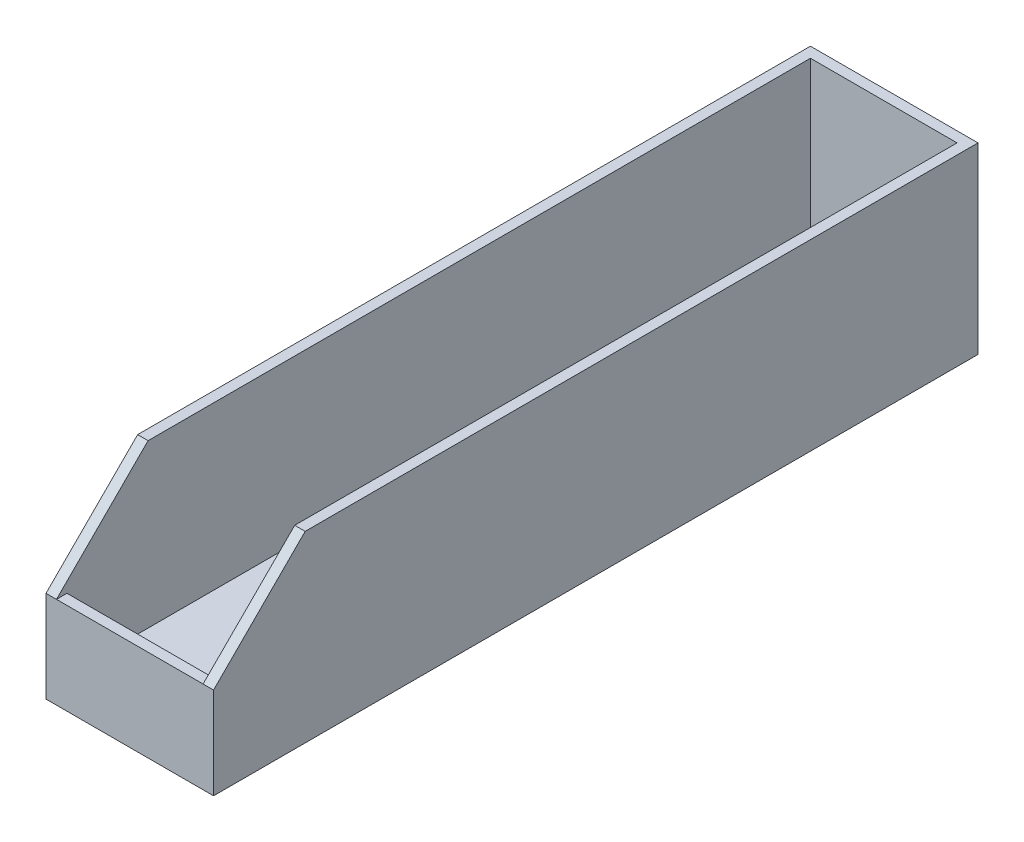
from build123d import *

# Parameters (mm, degrees)
SKETCH1_W           = 28
SKETCH1_H           = 142
BOSS_EXTRUDE1_DEPTH = 4
BOSS_EXTRUDE2_DEPTH = 35
SKETCH1_5_W         = 28
SKETCH1_5_H         = 2
BOSS_EXTRUDE3_DEPTH = 17.5
CUT_EXTRUDE1_REACH  = 82.907
SKETCH2_R           = 1.75
SKETCH2_3_R         = 3.15
SKETCH2_3_R_2       = 1.75
CUT_EXTRUDE2_DEPTH  = 2
CUT_EXTRUDE3_DEPTH  = 88.051708771


with BuildPart() as part:
    # Sketch1 → Boss-Extrude1 (new body)
    with BuildSketch(Plane(origin=(0, 0, 0), x_dir=(1, 0, 0), z_dir=(0, 1, 0))):
        Rectangle(SKETCH1_W, SKETCH1_H)
    extrude(amount=BOSS_EXTRUDE1_DEPTH)

    # Sketch1<4> → Boss-Extrude2 (add)
    with BuildSketch(Plane(origin=(0, 0, 0), x_dir=(1, 0, 0), z_dir=(0, 1, 0))):
        Polygon((-14, -73), (-14, -71), (-14, 71), (14, 71), (14, -71), (14, -73), (16, -73), (16, 73), (-16, 73), (-16, -73), align=None)
    extrude(amount=BOSS_EXTRUDE2_DEPTH)

    # Sketch1<5> → Boss-Extrude3 (add)
    with BuildSketch(Plane(origin=(0, 0, 0), x_dir=(1, 0, 0), z_dir=(0, 1, 0))):
        with Locations((0, -72)):
            Rectangle(SKETCH1_5_W, SKETCH1_5_H)
    extrude(amount=BOSS_EXTRUDE3_DEPTH)

    # Sketch2 → Cut-Extrude1 (cut, up to next)
    with BuildSketch(Plane(origin=(0, 4, 0), x_dir=(1, 0, 0), z_dir=(0, 1, 0)), mode=Mode.PRIVATE) as cut_extrude1_sk1:
        with Locations((0, 30)):
            Circle(SKETCH2_R)
    cut_extrude1_tool1 = extrude(cut_extrude1_sk1.sketch, amount=-CUT_EXTRUDE1_REACH, mode=Mode.PRIVATE) & part.part
    # Sketch2 → Cut-Extrude1 (cut, up to next)
    with BuildSketch(Plane(origin=(0, 4, 0), x_dir=(1, 0, 0), z_dir=(0, 1, 0)), mode=Mode.PRIVATE) as cut_extrude1_sk2:
        with Locations((0, -30)):
            Circle(SKETCH2_R)
    cut_extrude1_tool2 = extrude(cut_extrude1_sk2.sketch, amount=-CUT_EXTRUDE1_REACH, mode=Mode.PRIVATE) & part.part
    add(cut_extrude1_tool1.solids().sort_by_distance((0, 4, -30))[0], mode=Mode.SUBTRACT)
    add(cut_extrude1_tool2.solids().sort_by_distance((0, 4, 30))[0], mode=Mode.SUBTRACT)

    # Sketch2<3> → Cut-Extrude2 (cut)
    # profile 1 of 2: a face of its own
    with BuildSketch(Plane(origin=(0, 4, 0), x_dir=(1, 0, 0), z_dir=(0, 1, 0))):
        with Locations((0, 30)):
            Circle(SKETCH2_3_R)
        with Locations((0, 30)):
            Circle(SKETCH2_3_R_2, mode=Mode.SUBTRACT)
    # profile 2 of 2: a face of its own
    with BuildSketch(Plane(origin=(0, 4, 0), x_dir=(1, 0, 0), z_dir=(0, 1, 0))):
        with Locations((0, -30)):
            Circle(SKETCH2_3_R)
        with Locations((0, -30)):
            Circle(SKETCH2_3_R_2, mode=Mode.SUBTRACT)
    extrude(amount=-CUT_EXTRUDE2_DEPTH, mode=Mode.SUBTRACT)

    # Sketch3 → Cut-Extrude3 (cut, through all)
    with BuildSketch(Plane(origin=(16, 0, 0), x_dir=(0, 0, -1), z_dir=(1, 0, 0))):
        Polygon((-73, 17.5), (-55.5, 35), (-73, 35), align=None)
    extrude(amount=-CUT_EXTRUDE3_DEPTH, mode=Mode.SUBTRACT)


solid = part.part
